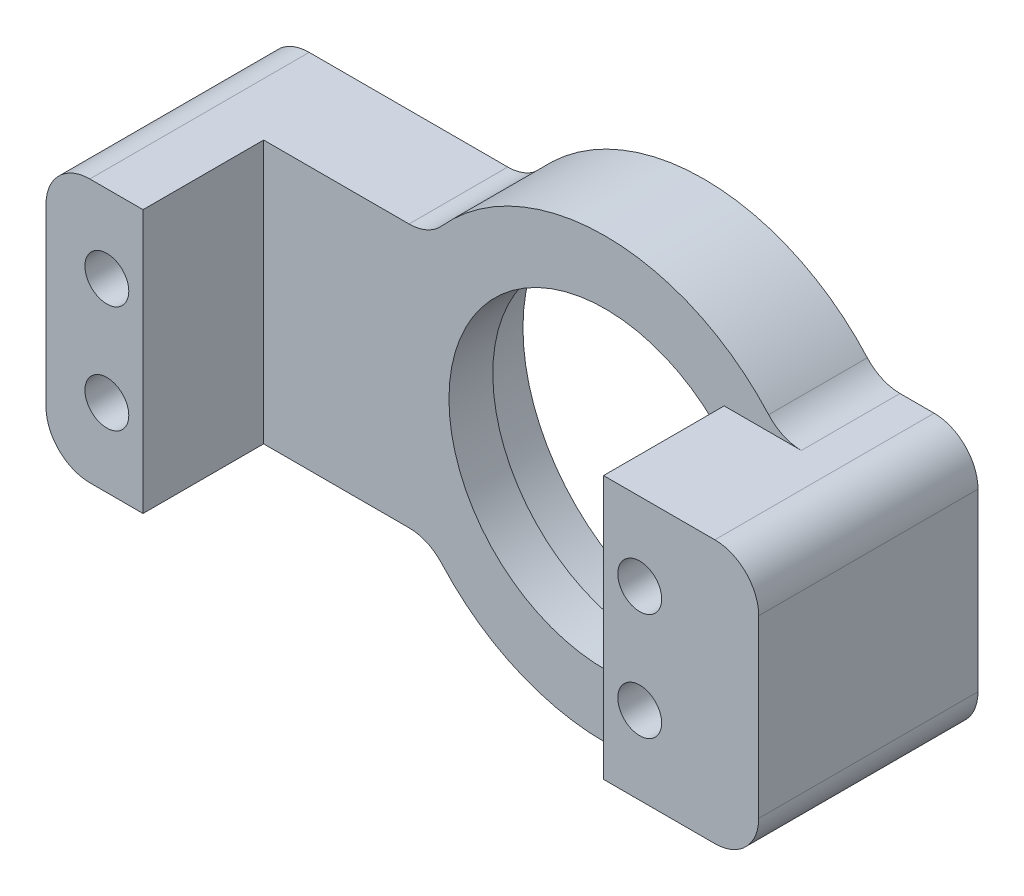
from build123d import *

# Parameters (mm, degrees)
SKETCH1_R           = 16.5
BOSS_EXTRUDE1_DEPTH = 5
SKETCH2_R           = 14.25
BOSS_EXTRUDE2_DEPTH = 4
SKETCH4_W           = 14.15
SKETCH4_H           = 24
SKETCH4_W_2         = 8.85
BOSS_EXTRUDE4_DEPTH = 11
FILLET1_R           = 4
SKETCH5_R           = 2
CUT_EXTRUDE1_DEPTH  = 8


with BuildPart() as part:
    # Sketch1 → Boss-Extrude1 (new body)
    with BuildSketch(Plane.XY):
        with BuildLine():
            Line((-40, 125.007283518), (-16, 125.007283518))
            ThreePointArc((-16, 125.007283518), (0, 133.007283518), (16, 125.007283518))
            Line((16, 125.007283518), (25, 125.007283518))
            Line((25, 125.007283518), (25, 101.007283518))
            Line((25, 101.007283518), (16, 101.007283518))
            ThreePointArc((16, 101.007283518), (0, 93.007283518), (-16, 101.007283518))
            Line((-16, 101.007283518), (-40, 101.007283518))
            Line((-40, 101.007283518), (-40, 125.007283518))
        make_face()
        with Locations((0, 113.007283518)):
            Circle(SKETCH1_R, mode=Mode.SUBTRACT)
    extrude(amount=BOSS_EXTRUDE1_DEPTH)

    # Sketch2 → Boss-Extrude2 (add)
    with BuildSketch(Plane.XY.offset(5)):
        with BuildLine():
            Line((-16, 125.007283518), (-40, 125.007283518))
            Line((-40, 125.007283518), (-40, 101.007283518))
            Line((-40, 101.007283518), (-16, 101.007283518))
            ThreePointArc((-16, 101.007283518), (0, 93.007283518), (16, 101.007283518))
            Line((16, 101.007283518), (25, 101.007283518))
            Line((25, 101.007283518), (25, 125.007283518))
            Line((25, 125.007283518), (16, 125.007283518))
            ThreePointArc((16, 125.007283518), (0, 133.007283518), (-16, 125.007283518))
        make_face()
        with Locations((0, 113.007283518)):
            Circle(SKETCH2_R, mode=Mode.SUBTRACT)
    extrude(amount=BOSS_EXTRUDE2_DEPTH)

    # Sketch4 → Boss-Extrude4 (add)
    with BuildSketch(Plane.XY.offset(9)):
        with Locations((17.925, 113.007283518)):
            Rectangle(SKETCH4_W, SKETCH4_H)
        with Locations((-35.575, 113.007283518)):
            Rectangle(SKETCH4_W_2, SKETCH4_H)
    extrude(amount=BOSS_EXTRUDE4_DEPTH)

    # Fillet1
    fillet1_edges = [part.edges().sort_by_distance(p)[0] for p in [
        (16, 125.007283518, 4.5),
        (-16, 125.007283518, 4.5),
        (-16, 101.007283518, 4.5),
        (16, 101.007283518, 4.5),
        (-40, 101.007283518, 10),
        (-40, 125.007283518, 10),
        (25, 125.007283518, 10),
        (25, 101.007283518, 10),
    ]]
    fillet(fillet1_edges, radius=FILLET1_R)

    # Sketch5 → Cut-Extrude1 (cut)
    with BuildSketch(Plane.XY.offset(20)):
        with Locations((-34.45, 108.107283518)):
            Circle(SKETCH5_R)
        with Locations((-34.45, 117.907283518)):
            Circle(SKETCH5_R)
        with Locations((14.15, 108.107283518)):
            Circle(SKETCH5_R)
        with Locations((14.15, 117.907283518)):
            Circle(SKETCH5_R)
    extrude(amount=-CUT_EXTRUDE1_DEPTH, mode=Mode.SUBTRACT)


solid = part.part
